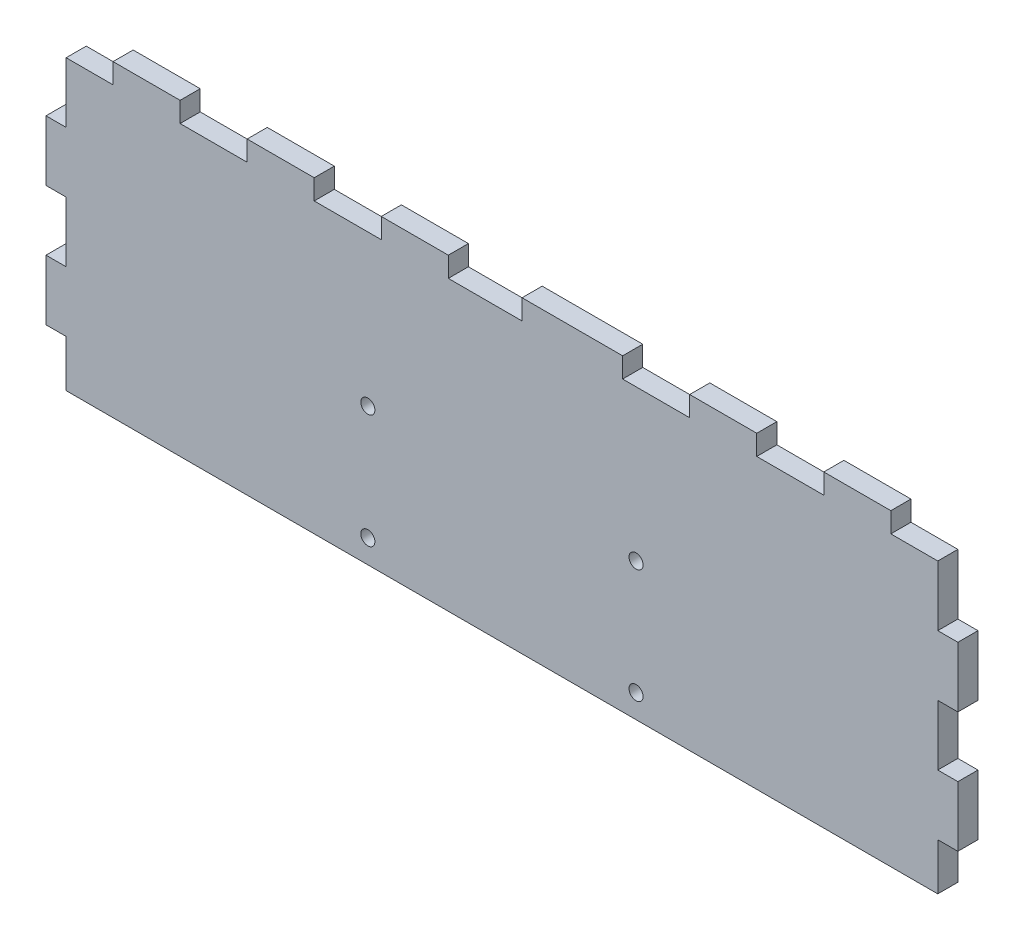
from build123d import *

# Parameters (mm, degrees)
SKETCH1_W           = 136
SKETCH1_H           = 46
SKETCH1_R           = 1.05
BOSS_EXTRUDE1_DEPTH = 3
CUT_EXTRUDE1_REACH  = 145.6
SKETCH4_W           = 3
SKETCH4_H           = 7
SKETCH4_H_2         = 9
SKETCH4_W_2         = 10
SKETCH4_H_3         = 3
SKETCH4_W_3         = 11


with BuildPart() as part:
    # Sketch1 → Boss-Extrude1 (new body)
    with BuildSketch(Plane.XY):
        with Locations((68, 23)):
            Rectangle(SKETCH1_W, SKETCH1_H)
        with Locations((88, 20.5)):
            Circle(SKETCH1_R, mode=Mode.SUBTRACT)
        with Locations((48, 20.5)):
            Circle(SKETCH1_R, mode=Mode.SUBTRACT)
        with Locations((48, 3.5)):
            Circle(SKETCH1_R, mode=Mode.SUBTRACT)
        with Locations((88, 3.5)):
            Circle(SKETCH1_R, mode=Mode.SUBTRACT)
    extrude(amount=BOSS_EXTRUDE1_DEPTH)

    # Sketch4 → Cut-Extrude1 (cut, up to next)
    with BuildSketch(Plane.XY.offset(3), mode=Mode.PRIVATE) as cut_extrude1_sk1:
        with Locations((134.5, 3.5)):
            Rectangle(SKETCH4_W, SKETCH4_H)
    cut_extrude1_tool1 = extrude(cut_extrude1_sk1.sketch, amount=-CUT_EXTRUDE1_REACH, mode=Mode.PRIVATE) & part.part
    # Sketch4 → Cut-Extrude1 (cut, up to next)
    with BuildSketch(Plane.XY.offset(3), mode=Mode.PRIVATE) as cut_extrude1_sk2:
        with Locations((134.5, 20.5)):
            Rectangle(SKETCH4_W, SKETCH4_H_2)
    cut_extrude1_tool2 = extrude(cut_extrude1_sk2.sketch, amount=-CUT_EXTRUDE1_REACH, mode=Mode.PRIVATE) & part.part
    # Sketch4 → Cut-Extrude1 (cut, up to next)
    with BuildSketch(Plane.XY.offset(3), mode=Mode.PRIVATE) as cut_extrude1_sk3:
        with Locations((1.5, 3.5)):
            Rectangle(SKETCH4_W, SKETCH4_H)
    cut_extrude1_tool3 = extrude(cut_extrude1_sk3.sketch, amount=-CUT_EXTRUDE1_REACH, mode=Mode.PRIVATE) & part.part
    # Sketch4 → Cut-Extrude1 (cut, up to next)
    with BuildSketch(Plane.XY.offset(3), mode=Mode.PRIVATE) as cut_extrude1_sk4:
        Polygon((133, 34), (136, 34), (136, 46), (126, 46), (126, 43), (133, 43), align=None)
    cut_extrude1_tool4 = extrude(cut_extrude1_sk4.sketch, amount=-CUT_EXTRUDE1_REACH, mode=Mode.PRIVATE) & part.part
    # Sketch4 → Cut-Extrude1 (cut, up to next)
    with BuildSketch(Plane.XY.offset(3), mode=Mode.PRIVATE) as cut_extrude1_sk5:
        with Locations((1.5, 20.5)):
            Rectangle(SKETCH4_W, SKETCH4_H_2)
    cut_extrude1_tool5 = extrude(cut_extrude1_sk5.sketch, amount=-CUT_EXTRUDE1_REACH, mode=Mode.PRIVATE) & part.part
    # Sketch4 → Cut-Extrude1 (cut, up to next)
    with BuildSketch(Plane.XY.offset(3), mode=Mode.PRIVATE) as cut_extrude1_sk6:
        Polygon((0, 34), (3, 34), (3, 43), (10, 43), (10, 46), (0, 46), align=None)
    cut_extrude1_tool6 = extrude(cut_extrude1_sk6.sketch, amount=-CUT_EXTRUDE1_REACH, mode=Mode.PRIVATE) & part.part
    # Sketch4 → Cut-Extrude1 (cut, up to next)
    with BuildSketch(Plane.XY.offset(3), mode=Mode.PRIVATE) as cut_extrude1_sk7:
        with Locations((111, 44.5)):
            Rectangle(SKETCH4_W_2, SKETCH4_H_3)
    cut_extrude1_tool7 = extrude(cut_extrude1_sk7.sketch, amount=-CUT_EXTRUDE1_REACH, mode=Mode.PRIVATE) & part.part
    # Sketch4 → Cut-Extrude1 (cut, up to next)
    with BuildSketch(Plane.XY.offset(3), mode=Mode.PRIVATE) as cut_extrude1_sk8:
        with Locations((91, 44.5)):
            Rectangle(SKETCH4_W_2, SKETCH4_H_3)
    cut_extrude1_tool8 = extrude(cut_extrude1_sk8.sketch, amount=-CUT_EXTRUDE1_REACH, mode=Mode.PRIVATE) & part.part
    # Sketch4 → Cut-Extrude1 (cut, up to next)
    with BuildSketch(Plane.XY.offset(3), mode=Mode.PRIVATE) as cut_extrude1_sk9:
        with Locations((25, 44.5)):
            Rectangle(SKETCH4_W_2, SKETCH4_H_3)
    cut_extrude1_tool9 = extrude(cut_extrude1_sk9.sketch, amount=-CUT_EXTRUDE1_REACH, mode=Mode.PRIVATE) & part.part
    # Sketch4 → Cut-Extrude1 (cut, up to next)
    with BuildSketch(Plane.XY.offset(3), mode=Mode.PRIVATE) as cut_extrude1_sk10:
        with Locations((65.5, 44.5)):
            Rectangle(SKETCH4_W_3, SKETCH4_H_3)
    cut_extrude1_tool10 = extrude(cut_extrude1_sk10.sketch, amount=-CUT_EXTRUDE1_REACH, mode=Mode.PRIVATE) & part.part
    # Sketch4 → Cut-Extrude1 (cut, up to next)
    with BuildSketch(Plane.XY.offset(3), mode=Mode.PRIVATE) as cut_extrude1_sk11:
        with Locations((45, 44.5)):
            Rectangle(SKETCH4_W_2, SKETCH4_H_3)
    cut_extrude1_tool11 = extrude(cut_extrude1_sk11.sketch, amount=-CUT_EXTRUDE1_REACH, mode=Mode.PRIVATE) & part.part
    add(cut_extrude1_tool1.solids().sort_by_distance((134.5, 3.5, 3))[0], mode=Mode.SUBTRACT)
    add(cut_extrude1_tool2.solids().sort_by_distance((134.5, 20.5, 3))[0], mode=Mode.SUBTRACT)
    add(cut_extrude1_tool3.solids().sort_by_distance((1.5, 3.5, 3))[0], mode=Mode.SUBTRACT)
    add(cut_extrude1_tool4.solids().sort_by_distance((134.5, 34.156205, 3))[0], mode=Mode.SUBTRACT)
    add(cut_extrude1_tool5.solids().sort_by_distance((1.5, 20.5, 3))[0], mode=Mode.SUBTRACT)
    add(cut_extrude1_tool6.solids().sort_by_distance((0.156205, 40, 3))[0], mode=Mode.SUBTRACT)
    add(cut_extrude1_tool7.solids().sort_by_distance((111, 44.5, 3))[0], mode=Mode.SUBTRACT)
    add(cut_extrude1_tool8.solids().sort_by_distance((91, 44.5, 3))[0], mode=Mode.SUBTRACT)
    add(cut_extrude1_tool9.solids().sort_by_distance((25, 44.5, 3))[0], mode=Mode.SUBTRACT)
    add(cut_extrude1_tool10.solids().sort_by_distance((65.5, 44.5, 3))[0], mode=Mode.SUBTRACT)
    add(cut_extrude1_tool11.solids().sort_by_distance((45, 44.5, 3))[0], mode=Mode.SUBTRACT)


solid = part.part
